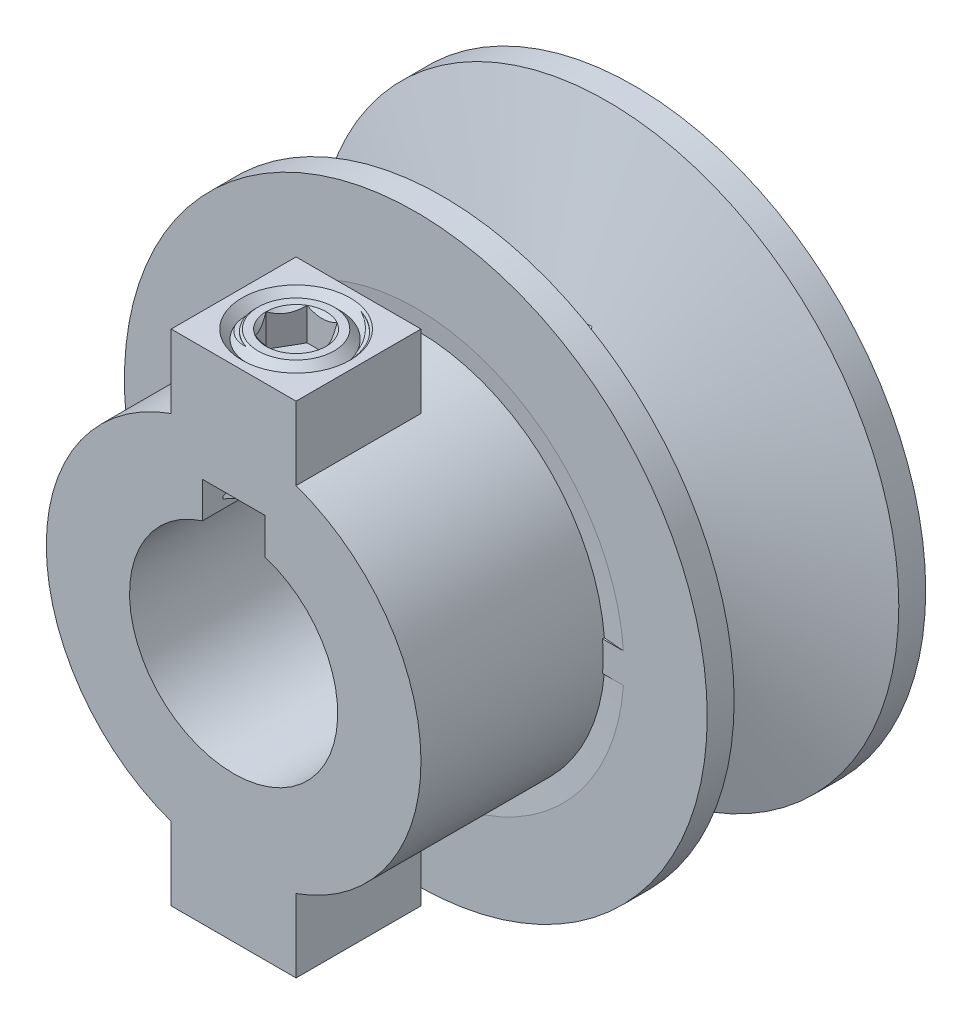
from build123d import *

# Parameters (mm, degrees)
BOSS_EXTRUDE1_DEPTH      = 1.143
CIRPATTERN1_COUNT        = 2
SKETCH3_R                = 7.9375
CUT_EXTRUDE1_DEPTH       = 30.5562
SKETCH4_W                = 4.7625
SKETCH4_H                = 4.7625
CUT_EXTRUDE2_DEPTH       = 30.5562
BOSS_EXTRUDE2_REACH      = 54.94
BOSS_EXTRUDE2_END_RADIUS = 14.2875
BOSS_EXTRUDE2_START      = 4.7625
SKETCH5_W                = 9.525
SKETCH5_H                = 9.525
SKETCH6_R                = 3.086805556
CUT_EXTRUDE3_DEPTH       = 19.05
CUT_SWEEP1_PITCH         = 1.411111111
CUT_SWEEP2_PITCH         = 1.411111111
CUT_EXTRUDE5_DEPTH       = 2.48046875


with BuildPart() as part:
    # Sketch1 → Revolve1 (revolve)
    with BuildSketch(Plane(origin=(0, 0, 0), x_dir=(0, 0, -1), z_dir=(1, 0, 0)), mode=Mode.PRIVATE) as revolve1_sk:
        Polygon((6.279294914, 22.225), (8.3312, 22.225), (8.3312, 15.875), (8.192311747, 14.2875), (8.3312, 14.2875), (8.3312, 0), (-22.225, 0), (-22.225, 14.2875), (-8.73125, 14.2875), (-8.192311747, 14.2875), (-8.3312, 15.875), (-8.3312, 22.225), (-6.279294914, 22.225), (-2.396515259, 9.525), (2.396515259, 9.525), align=None)
    revolve(revolve1_sk.sketch.rotate(Axis((0, 0, 22.225), (0, 0, -1)), 90), axis=Axis((0, 0, 22.225), (0, 0, -1)))

    # Sketch2 → Boss-Extrude1 (add, symmetric)
    with BuildSketch(Plane(origin=(0, 0, 0), x_dir=(0, 0, -1), z_dir=(0, 1, 0))):
        Polygon((-8.170089626, 14.0335), (-8.3312, 15.875), (-8.3312, 14.0335), align=None)
        Polygon((8.3312, 14.0335), (8.170089626, 14.0335), (8.3312, 15.875), align=None)
    boss_extrude1 = extrude(amount=BOSS_EXTRUDE1_DEPTH, both=True)

    # CirPattern1: Boss-Extrude1 ×2 about axis
    cirpattern1_axis = Axis((0, 0, 0), (0, 0, -1))
    for i in range(1, CIRPATTERN1_COUNT):
        add(boss_extrude1.rotate(cirpattern1_axis, i * 360 / CIRPATTERN1_COUNT))

    # Sketch3 → Cut-Extrude1 (cut)
    with BuildSketch(Plane(origin=(0, 0, -8.3312), x_dir=(-1, 0, 0), z_dir=(0, 0, -1))):
        with Locations(Location((0, 0, 0), (0, 0, 90))):
            Circle(SKETCH3_R)
    extrude(amount=-CUT_EXTRUDE1_DEPTH, mode=Mode.SUBTRACT)

    # Sketch4 → Cut-Extrude2 (cut)
    with BuildSketch(Plane(origin=(0, 0, -8.3312), x_dir=(-1, 0, 0), z_dir=(0, 0, -1))):
        with Locations((0, 7.9375)):
            Rectangle(SKETCH4_W, SKETCH4_H)
    extrude(amount=-CUT_EXTRUDE2_DEPTH, mode=Mode.SUBTRACT)

    # Boss-Extrude2: up to this cylinder (the profile starts outside it)
    boss_extrude2_end = Plane(origin=(0, 0, 17.4625), z_dir=(0, 0, 1)) * Cylinder(BOSS_EXTRUDE2_END_RADIUS, 139.455, mode=Mode.PRIVATE)
    # Sketch5 → Boss-Extrude2 (add, up to the surface)
    with BuildSketch(Plane(origin=(0, 14.2875, 0), x_dir=(-1, 0, 0), z_dir=(0, 1, 0)).offset(BOSS_EXTRUDE2_START), mode=Mode.PRIVATE) as boss_extrude2_sk1:
        with Locations((0, 17.4625)):
            Rectangle(SKETCH5_W, SKETCH5_H)
    boss_extrude2_tool1 = extrude(boss_extrude2_sk1.sketch, amount=-BOSS_EXTRUDE2_REACH, mode=Mode.PRIVATE) - boss_extrude2_end
    boss_extrude2 = boss_extrude2_tool1.solids().sort_by_distance((0, 19.05, 17.4625))[0]
    add(boss_extrude2)

    # Mirror1: Boss-Extrude2 across plane
    add(boss_extrude2.mirror(Plane.ZX))

    # Sketch6 → Cut-Extrude3 (cut)
    with BuildSketch(Plane(origin=(0, 19.05, 0), x_dir=(-1, 0, 0), z_dir=(0, 1, 0))):
        with Locations(Location((0, 17.4625, 0), (0, 0, 90))):
            Circle(SKETCH6_R)
    extrude(amount=-CUT_EXTRUDE3_DEPTH, mode=Mode.SUBTRACT)

    # Cut-Sweep1: the profile of Sketch8 screwed along a right-hand helix of 11.125 turns, 8 arcs to a turn; built about Z, then put on its axis
    cut_sweep1_z = Axis((0, 0, 0), (0, 0, 1))
    cut_sweep1_corners = [(2.975827818, 0, -1.367013889), (2.975827818, 0, -0.044097222), (3.96875, 0, -0.617361111), (3.96875, 0, -0.79375)]
    with BuildLine(mode=Mode.PRIVATE) as cut_sweep1_profile:
        Line(cut_sweep1_corners[0], cut_sweep1_corners[1])
        Line(cut_sweep1_corners[1], cut_sweep1_corners[2])
        Line(cut_sweep1_corners[2], cut_sweep1_corners[3])
        Line(cut_sweep1_corners[3], cut_sweep1_corners[0])
    cut_sweep1_cap = Face(cut_sweep1_profile.wire())
    cut_sweep1_turn_angles = [0, 22.5, 45, 67.5, 90, 112.5, 135, 157.5, 180, 202.5, 225, 247.5, 270, 292.5, 315, 337.5, 360]
    cut_sweep1_turn_weights = [1, 0.9238795325112867, 1, 0.9238795325112867, 1, 0.9238795325112867, 1, 0.9238795325112867, 1, 0.9238795325112867, 1, 0.9238795325112867, 1, 0.9238795325112867, 1, 0.9238795325112867, 1]
    cut_sweep1_turn_rails = [Edge.make_bspline([Vector(p[0], p[1], 0).rotate(cut_sweep1_z, cut_sweep1_turn_angles[k]) / cut_sweep1_turn_weights[k] + Vector(0, 0, p[2] + CUT_SWEEP1_PITCH * cut_sweep1_turn_angles[k] / 360) for k in range(17)], [0, 0, 0, 1, 1, 2, 2, 3, 3, 4, 4, 5, 5, 6, 6, 7, 7, 8, 8, 8], 2, cut_sweep1_turn_weights) for p in cut_sweep1_corners]
    cut_sweep1_turn_sides = [Face.make_surface_from_curves(cut_sweep1_turn_rails[p[0]], cut_sweep1_turn_rails[p[1]]) for p in [(0, 1), (1, 2), (2, 3), (3, 0)]]
    cut_sweep1_last_angles = [3960, 3982.5, 4005]
    cut_sweep1_last_weights = [1, 0.9238795325112594, 1]
    cut_sweep1_last_rails = [Edge.make_bspline([Vector(p[0], p[1], 0).rotate(cut_sweep1_z, cut_sweep1_last_angles[k]) / cut_sweep1_last_weights[k] + Vector(0, 0, p[2] + CUT_SWEEP1_PITCH * cut_sweep1_last_angles[k] / 360) for k in range(3)], [0, 0, 0, 1, 1, 1], 2, cut_sweep1_last_weights) for p in cut_sweep1_corners]
    cut_sweep1_last_sides = [Face.make_surface_from_curves(cut_sweep1_last_rails[p[0]], cut_sweep1_last_rails[p[1]]) for p in [(0, 1), (1, 2), (2, 3), (3, 0)]]
    cut_sweep1 = Plane(origin=(0, 19.05, 17.4625), x_dir=(0, 0, 1), z_dir=(0, -1, 0)) * Solid(Shell([*[p.moved(Location((0, 0, CUT_SWEEP1_PITCH * i))) for i in range(11) for p in cut_sweep1_turn_sides], *cut_sweep1_last_sides, cut_sweep1_cap, cut_sweep1_cap.rotate(cut_sweep1_z, 4005).moved(Location((0, 0, CUT_SWEEP1_PITCH * 4005 / 360)))]))
    add(cut_sweep1, mode=Mode.SUBTRACT)

    # Cut-Extrude4 cone 1 section (through the dimple's axis) → Cut-Extrude4 (revolve, cut)
    with BuildSketch(Plane(origin=(0, 19.05, 17.4625), x_dir=(0, 0, 1), z_dir=(1, 0, 0))):
        Polygon((0, 0), (4.121507259, 0), (0, 4.121507259), align=None)
    revolve(axis=Axis((0, 19.05, 17.4625), (0, -1, 0)), mode=Mode.SUBTRACT)


with BuildPart() as body_2:
    # Sketch10 → Revolve3 (revolve)
    with BuildSketch(Plane(origin=(0, 0, 0), x_dir=(0, 0, -1), z_dir=(1, 0, 0))):
        Polygon((-21.43125, 10.594300811), (-21.43125, 17.980699189), (-20.361949189, 19.05), (-17.4625, 19.05), (-17.4625, 9.525), (-20.361949189, 9.525), align=None)
    revolve(axis=Axis((0, 19.05, 17.4625), (0, -1, 0)))

    # Cut-Sweep2: the profile of Sketch12 screwed along a right-hand helix of 7.75 turns, 8 arcs to a turn; built about Z, then put on its axis
    cut_sweep2_z = Axis((0, 0, 0), (0, 0, 1))
    cut_sweep2_corners = [(4.045128629, 0, -0.661458333), (4.045128629, 0, 0.661458333), (3.052206448, 0, 0.088194444), (3.052206448, 0, -0.088194444)]
    with BuildLine(mode=Mode.PRIVATE) as cut_sweep2_profile:
        Line(cut_sweep2_corners[0], cut_sweep2_corners[1])
        Line(cut_sweep2_corners[1], cut_sweep2_corners[2])
        Line(cut_sweep2_corners[2], cut_sweep2_corners[3])
        Line(cut_sweep2_corners[3], cut_sweep2_corners[0])
    cut_sweep2_cap = Face(cut_sweep2_profile.wire())
    cut_sweep2_turn_angles = [0, 22.5, 45, 67.5, 90, 112.5, 135, 157.5, 180, 202.5, 225, 247.5, 270, 292.5, 315, 337.5, 360]
    cut_sweep2_turn_weights = [1, 0.9238795325112867, 1, 0.9238795325112867, 1, 0.9238795325112867, 1, 0.9238795325112867, 1, 0.9238795325112867, 1, 0.9238795325112867, 1, 0.9238795325112867, 1, 0.9238795325112867, 1]
    cut_sweep2_turn_rails = [Edge.make_bspline([Vector(p[0], p[1], 0).rotate(cut_sweep2_z, cut_sweep2_turn_angles[k]) / cut_sweep2_turn_weights[k] + Vector(0, 0, p[2] + CUT_SWEEP2_PITCH * cut_sweep2_turn_angles[k] / 360) for k in range(17)], [0, 0, 0, 1, 1, 2, 2, 3, 3, 4, 4, 5, 5, 6, 6, 7, 7, 8, 8, 8], 2, cut_sweep2_turn_weights) for p in cut_sweep2_corners]
    cut_sweep2_turn_sides = [Face.make_surface_from_curves(cut_sweep2_turn_rails[p[0]], cut_sweep2_turn_rails[p[1]]) for p in [(0, 1), (1, 2), (2, 3), (3, 0)]]
    cut_sweep2_last_angles = [2520, 2542.5, 2565, 2587.5, 2610, 2632.5, 2655, 2677.5, 2700, 2722.5, 2745, 2767.5, 2790]
    cut_sweep2_last_weights = [1, 0.9238795325112867, 1, 0.9238795325112867, 1, 0.9238795325112867, 1, 0.9238795325112867, 1, 0.9238795325112867, 1, 0.9238795325112792, 1]
    cut_sweep2_last_rails = [Edge.make_bspline([Vector(p[0], p[1], 0).rotate(cut_sweep2_z, cut_sweep2_last_angles[k]) / cut_sweep2_last_weights[k] + Vector(0, 0, p[2] + CUT_SWEEP2_PITCH * cut_sweep2_last_angles[k] / 360) for k in range(13)], [0, 0, 0, 1, 1, 2, 2, 3, 3, 4, 4, 5, 5, 6, 6, 6], 2, cut_sweep2_last_weights) for p in cut_sweep2_corners]
    cut_sweep2_last_sides = [Face.make_surface_from_curves(cut_sweep2_last_rails[p[0]], cut_sweep2_last_rails[p[1]]) for p in [(0, 1), (1, 2), (2, 3), (3, 0)]]
    cut_sweep2 = Plane(origin=(0, 19.05, 17.4625), x_dir=(0, 0, 1), z_dir=(0, -1, 0)) * Solid(Shell([*[p.moved(Location((0, 0, CUT_SWEEP2_PITCH * i))) for i in range(7) for p in cut_sweep2_turn_sides], *cut_sweep2_last_sides, cut_sweep2_cap, cut_sweep2_cap.rotate(cut_sweep2_z, 2790).moved(Location((0, 0, CUT_SWEEP2_PITCH * 2790 / 360)))]))
    add(cut_sweep2, mode=Mode.SUBTRACT)

    # Sketch13 → Cut-Extrude5 (cut)
    with BuildSketch(Plane(origin=(0, 19.05, 0), x_dir=(1, 0, 0), z_dir=(0, 1, 0))):
        Polygon((2.291358881, -17.4625), (1.14567944, -15.478125), (-1.14567944, -15.478125), (-2.291358881, -17.4625), (-1.14567944, -19.446875), (1.14567944, -19.446875), align=None)
    extrude(amount=-CUT_EXTRUDE5_DEPTH, mode=Mode.SUBTRACT)

    # Cut-Extrude6 cone 1 section (through the dimple's axis) → Cut-Extrude6 (revolve, cut)
    with BuildSketch(Plane(origin=(0, 19.05, 17.4625), x_dir=(0, 0, 1), z_dir=(1, 0, 0))):
        Polygon((0, 0), (2.291358881, 0), (0, 2.291358881), align=None)
    revolve(axis=Axis((0, 19.05, 17.4625), (0, -1, 0)), mode=Mode.SUBTRACT)


solid = Compound([part.part, body_2.part])
